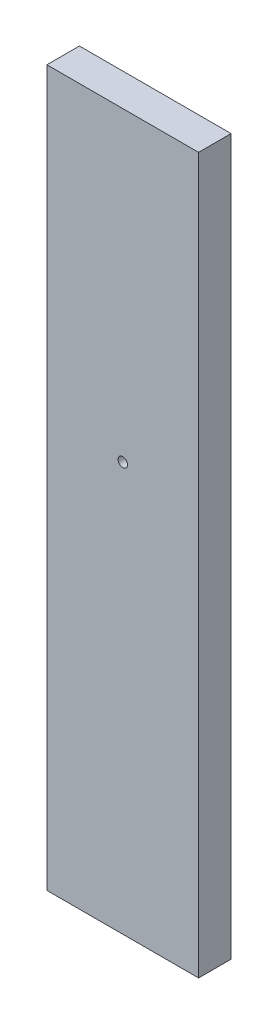
from build123d import *

# Parameters (mm, degrees)
SKETCH1_W           = 88.9
SKETCH1_H           = 19.05
BOSS_EXTRUDE1_DEPTH = 419.1
SKETCH2_R           = 2.778125
CUT_EXTRUDE1_DEPTH  = 429.848367725


with BuildPart() as part:
    # Sketch1 → Boss-Extrude1 (new body)
    with BuildSketch(Plane(origin=(0, 0, 0), x_dir=(1, 0, 0), z_dir=(0, 1, 0))):
        with Locations((44.45, 9.525)):
            Rectangle(SKETCH1_W, SKETCH1_H)
    extrude(amount=BOSS_EXTRUDE1_DEPTH)

    # Sketch2 → Cut-Extrude1 (cut, through all)
    with BuildSketch(Plane.XY):
        with Locations((44.45, 239.641634)):
            Circle(SKETCH2_R)
    extrude(amount=-CUT_EXTRUDE1_DEPTH, mode=Mode.SUBTRACT)


solid = part.part
